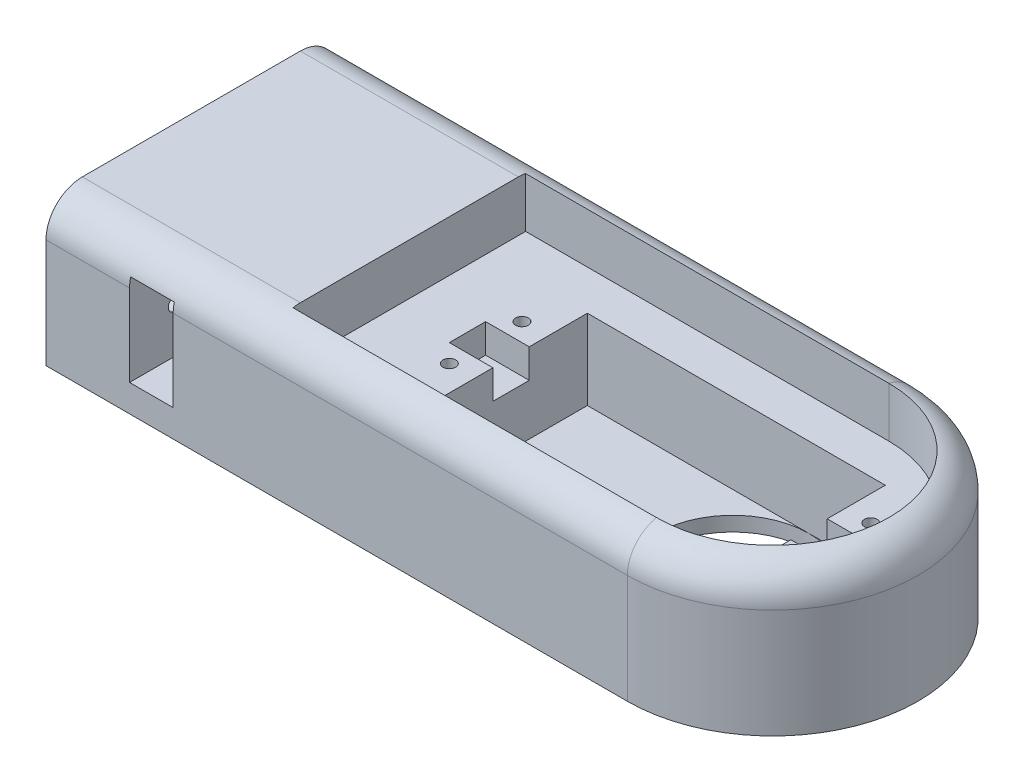
from build123d import *

# Parameters (mm, degrees)
BOSS_EXTRUDE1_DEPTH     = 20
SKETCH2_R               = 0.875
SKETCH2_W               = 41
SKETCH2_H               = 21
CUT_EXTRUDE2_DEPTH      = 7
SKETCH2_7_W             = 41
SKETCH2_7_H             = 10
SKETCH2_7_H_2           = 5.5
CUT_EXTRUDE3_DEPTH      = 18
SKETCH2_8_R             = 0.875
CUT_EXTRUDE4_DEPTH      = 16
SKETCH5_R               = 10.5
CUT_EXTRUDE5_DEPTH      = 16
SKETCH6_R               = 0.875
SKETCH6_W               = 23
SKETCH6_H               = 12.5
CUT_EXTRUDE6_DEPTH      = 17.5
FILLET1_R               = 5
SKETCH7_W               = 6
SKETCH7_H               = 5
SKETCH7_H_2             = 2.5
CUT_EXTRUDE7_DEPTH      = 4
CUT_EXTRUDE8_DEPTH      = 107.73448365
CUT_EXTRUDE8_DEPTH_BACK = 107.73448365
SKETCH8_W               = 6
SKETCH8_H               = 12.5


with BuildPart() as part:
    # Sketch1 → Boss-Extrude1 (new body)
    with BuildSketch(Plane(origin=(0, 0, 0), x_dir=(1, 0, 0), z_dir=(0, 1, 0))):
        with BuildLine():
            Line((0, 40), (0, 0))
            Line((0, 0), (80, 0))
            ThreePointArc((80, 0), (100, 20), (80, 40))
            Line((80, 40), (0, 40))
        make_face()
    extrude(amount=BOSS_EXTRUDE1_DEPTH)

    # Sketch2 → Cut-Extrude2 (cut)
    with BuildSketch(Plane(origin=(0, 20, 0), x_dir=(1, 0, 0), z_dir=(0, 1, 0))):
        with BuildLine():
            Line((30, 36), (30, 4))
            Line((30, 4), (80, 4))
            ThreePointArc((80, 4), (96, 20), (80, 36))
            Line((80, 36), (30, 36))
        make_face()
        with Locations(Location((40.5, 25, 0), (0, 0, 270))):
            Circle(SKETCH2_R, mode=Mode.SUBTRACT)
        with Locations(Location((40.5, 15, 0), (0, 0, 270))):
            Circle(SKETCH2_R, mode=Mode.SUBTRACT)
        with Locations(Location((88.5, 25, 0), (0, 0, 270))):
            Circle(SKETCH2_R, mode=Mode.SUBTRACT)
        with Locations(Location((88.5, 15, 0), (0, 0, 270))):
            Circle(SKETCH2_R, mode=Mode.SUBTRACT)
        with Locations((64.5, 20)):
            Rectangle(SKETCH2_W, SKETCH2_H, mode=Mode.SUBTRACT)
    extrude(amount=-CUT_EXTRUDE2_DEPTH, mode=Mode.SUBTRACT)

    # Sketch2<7> → Cut-Extrude3 (cut)
    with BuildSketch(Plane(origin=(0, 20, 0), x_dir=(1, 0, 0), z_dir=(0, 1, 0))):
        with Locations((64.5, 20)):
            Rectangle(SKETCH2_7_W, SKETCH2_7_H)
        with Locations((64.5, 12.25)):
            Rectangle(SKETCH2_7_W, SKETCH2_7_H_2)
        with Locations((64.5, 27.75)):
            Rectangle(SKETCH2_7_W, SKETCH2_7_H_2)
    extrude(amount=-CUT_EXTRUDE3_DEPTH, mode=Mode.SUBTRACT)

    # Sketch2<8> → Cut-Extrude4 (cut)
    with BuildSketch(Plane(origin=(0, 20, 0), x_dir=(1, 0, 0), z_dir=(0, 1, 0))):
        with Locations(Location((40.5, 25, 0), (0, 0, 270))):
            Circle(SKETCH2_8_R)
        with Locations(Location((40.5, 15, 0), (0, 0, 270))):
            Circle(SKETCH2_8_R)
        with Locations(Location((88.5, 25, 0), (0, 0, 270))):
            Circle(SKETCH2_8_R)
        with Locations(Location((88.5, 15, 0), (0, 0, 270))):
            Circle(SKETCH2_8_R)
    extrude(amount=-CUT_EXTRUDE4_DEPTH, mode=Mode.SUBTRACT)

    # Sketch5 → Cut-Extrude5 (cut)
    with BuildSketch(Plane(origin=(0, 2, 0), x_dir=(1, 0, 0), z_dir=(0, 1, 0))):
        with Locations(Location((74.5, 20, 0), (0, 0, 270))):
            Circle(SKETCH5_R)
    extrude(amount=-CUT_EXTRUDE5_DEPTH, mode=Mode.SUBTRACT)

    # Sketch6 → Cut-Extrude6 (cut)
    with BuildSketch(Plane.ZY):
        with Locations((-6.2, 10)):
            Circle(SKETCH6_R)
        with Locations((-33.8, 10)):
            Circle(SKETCH6_R)
        with Locations((-20, 10)):
            Rectangle(SKETCH6_W, SKETCH6_H)
    extrude(amount=-CUT_EXTRUDE6_DEPTH, mode=Mode.SUBTRACT)

    # Fillet1
    # the kernel refuses this fillet: 5 mm, written as the material it takes off along each edge
    with BuildSketch(Plane(origin=(80, 20, -40), x_dir=(0, -1, 0), z_dir=(-1, 0, 0))) as fillet1_piece_1:
        with BuildLine():
            CenterArc((FILLET1_R, FILLET1_R), FILLET1_R, 180, 90)
            Line((0, FILLET1_R), (0, 0))
            Line((0, 0), (FILLET1_R, 0))
        make_face()
    extrude(amount=92.5, mode=Mode.SUBTRACT)
    with BuildSketch(Plane(origin=(-12.5, 20, 0), x_dir=(0, 0, -1), z_dir=(1, 0, 0))) as fillet1_piece_2:
        with BuildLine():
            CenterArc((FILLET1_R, -FILLET1_R), FILLET1_R, 90, 90)
            Line((0, -FILLET1_R), (0, 0))
            Line((0, 0), (FILLET1_R, 0))
        make_face()
    extrude(amount=92.5, mode=Mode.SUBTRACT)
    with BuildSketch(Plane(origin=(80, 20, -20), x_dir=(0, 0, 1), z_dir=(-1, 0, 0))) as fillet1_piece_3:
        with BuildLine():
            CenterArc((20 - FILLET1_R, -FILLET1_R), FILLET1_R, 0, 90)
            Line((20 - FILLET1_R, 0), (20, 0))
            Line((20, 0), (20, -FILLET1_R))
        make_face()
    revolve(axis=Axis((80, 20, -20), (0, 1, 0)), revolution_arc=180, mode=Mode.SUBTRACT)

    # Sketch7 → Cut-Extrude7 (cut)
    with BuildSketch(Plane(origin=(0, 13, 0), x_dir=(1, 0, 0), z_dir=(0, 1, 0))):
        Polygon((85, 17.5), (85, 20), (85, 22.5), (44, 22.5), (44, 17.5), align=None)
        with Locations((41, 20)):
            Rectangle(SKETCH7_W, SKETCH7_H)
        with Locations((88, 18.75)):
            Rectangle(SKETCH7_W, SKETCH7_H_2)
        with Locations((88, 21.25)):
            Rectangle(SKETCH7_W, SKETCH7_H_2)
    extrude(amount=-CUT_EXTRUDE7_DEPTH, mode=Mode.SUBTRACT)

    # Sketch8 → Cut-Extrude8 (cut, two sides: drawn at the far end of the back side and taken through both)
    with BuildSketch(Plane(origin=(0, 0, -8.5), x_dir=(-1, 0, 0), z_dir=(0, 0, -1)).offset(-CUT_EXTRUDE8_DEPTH_BACK)):
        with Locations((-14.5, 10)):
            Rectangle(SKETCH8_W, SKETCH8_H)
    extrude(amount=CUT_EXTRUDE8_DEPTH + CUT_EXTRUDE8_DEPTH_BACK, mode=Mode.SUBTRACT)


solid = part.part
